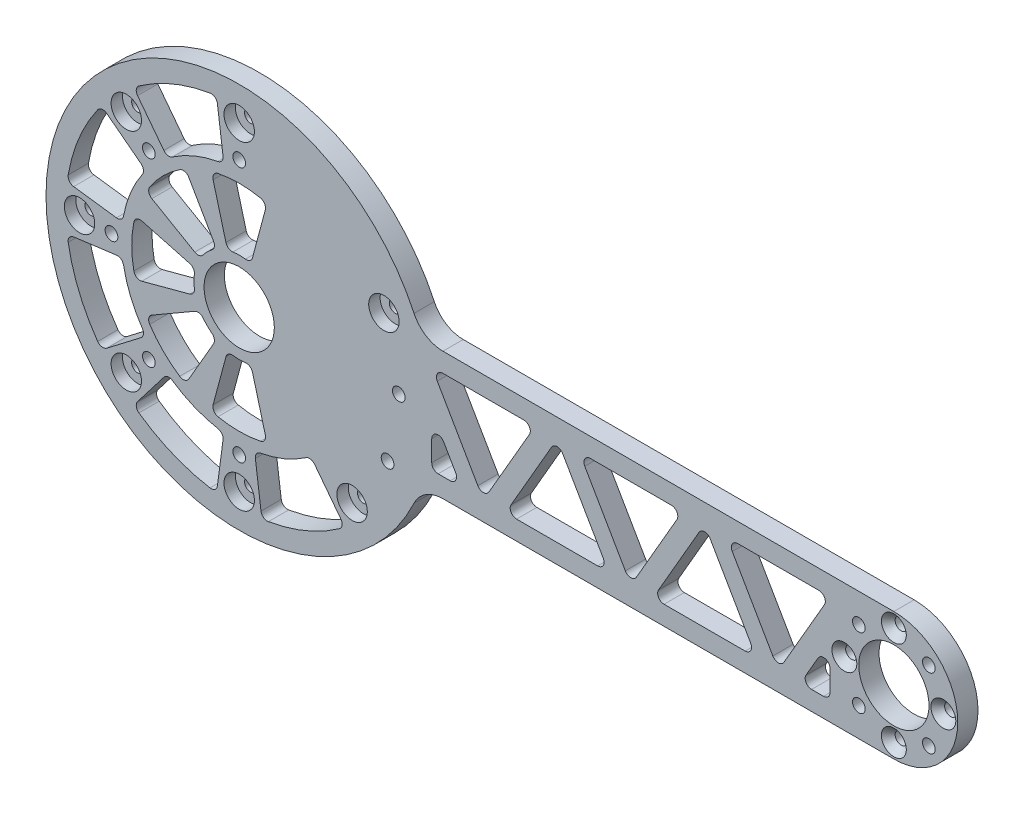
from build123d import *
from OCP.BRepFilletAPI import BRepFilletAPI_MakeChamfer

# Parameters (mm, degrees)
SKETCH1_R                = 11
SKETCH1_R_2              = 1.89865
SKETCH1_R_3              = 1.9939
BOSS_EXTRUDE1_DEPTH      = 6.35
FILLET1_R                = 10
CUT_EXTRUDE1_DEPTH       = 234.078468547
FILLET2_R                = 2
CUT_EXTRUDE2_DEPTH       = 234.078468547
FILLET3_R                = 2
CIRPATTERN1_COUNT        = 8
FILLET3_OF_CIRPATTERN1_R = 2
CUT_EXTRUDE4_DEPTH       = 234.078468547
FILLET5_R                = 2
CIRPATTERN3_COUNT        = 8
FILLET5_OF_CIRPATTERN3_R = 2
CHAMFER1_SIZE            = 2.301024407
CHAMFER1_SIZE2           = 2.00025
CUT_EXTRUDE5_START       = -3.571875
SKETCH6_R                = 4.7625
SKETCH6_R_2              = 1.89865
CUT_EXTRUDE5_DEPTH       = 3.571875


with BuildPart() as part:
    # Sketch1 → Boss-Extrude1 (new body)
    with BuildSketch(Plane.XY):
        with BuildLine():
            Line((57.098598932, -20), (205, -20))
            ThreePointArc((205, -20), (225, 0), (205, 20))
            Line((205, 20), (57.098598932, 20))
            ThreePointArc((57.098598932, 20), (-60.5, 0), (57.098598932, -20))
        make_face()
        Circle(SKETCH1_R, mode=Mode.SUBTRACT)
        with Locations((45.315389352, 21.130913087)):
            Circle(SKETCH1_R_2, mode=Mode.SUBTRACT)
        with Locations((49.978847504, 1.454235937)):
            Circle(SKETCH1_R_3, mode=Mode.SUBTRACT)
        with Locations((205, 0)):
            Circle(SKETCH1_R, mode=Mode.SUBTRACT)
        with Locations((46.467376211, -18.460307366)):
            Circle(SKETCH1_R_3, mode=Mode.SUBTRACT)
        with Locations((205, -15.5)):
            Circle(SKETCH1_R_2, mode=Mode.SUBTRACT)
        with Locations((215.960155108, -10.960155108)):
            Circle(SKETCH1_R_3, mode=Mode.SUBTRACT)
        with Locations((189.5, 0)):
            Circle(SKETCH1_R_2, mode=Mode.SUBTRACT)
        with Locations((194.039844892, -10.960155108)):
            Circle(SKETCH1_R_3, mode=Mode.SUBTRACT)
        with Locations((205, 15.5)):
            Circle(SKETCH1_R_2, mode=Mode.SUBTRACT)
        with Locations((194.039844892, 10.960155108)):
            Circle(SKETCH1_R_3, mode=Mode.SUBTRACT)
        with Locations((220.5, 0)):
            Circle(SKETCH1_R_2, mode=Mode.SUBTRACT)
        with Locations((215.960155108, 10.960155108)):
            Circle(SKETCH1_R_3, mode=Mode.SUBTRACT)
        with Locations((0, -40)):
            Circle(SKETCH1_R_3, mode=Mode.SUBTRACT)
        with Locations((0, -50)):
            Circle(SKETCH1_R_2, mode=Mode.SUBTRACT)
        with Locations((-28.284271247, -28.284271247)):
            Circle(SKETCH1_R_3, mode=Mode.SUBTRACT)
        with Locations((-35.355339059, -35.355339059)):
            Circle(SKETCH1_R_2, mode=Mode.SUBTRACT)
        with Locations((-40, 0)):
            Circle(SKETCH1_R_3, mode=Mode.SUBTRACT)
        with Locations((-50, 0)):
            Circle(SKETCH1_R_2, mode=Mode.SUBTRACT)
        with Locations((-28.284271247, 28.284271247)):
            Circle(SKETCH1_R_3, mode=Mode.SUBTRACT)
        with Locations((-35.355339059, 35.355339059)):
            Circle(SKETCH1_R_2, mode=Mode.SUBTRACT)
        with Locations((0, 40)):
            Circle(SKETCH1_R_3, mode=Mode.SUBTRACT)
        with Locations((0, 50)):
            Circle(SKETCH1_R_2, mode=Mode.SUBTRACT)
        with Locations((35.355339059, -35.355339059)):
            Circle(SKETCH1_R_2, mode=Mode.SUBTRACT)
    extrude(amount=BOSS_EXTRUDE1_DEPTH)

    # Fillet1
    fillet1_edges = [part.edges().sort_by_distance(p)[0] for p in [
        (57.098598932, -20, 3.175),
        (57.098598932, 20, 3.175),
    ]]
    fillet(fillet1_edges, radius=FILLET1_R)

    # Sketch2 → Cut-Extrude1 (cut, through all)
    with BuildSketch(Plane.XY.offset(6.35)):
        Polygon((60.292341855, 14), (92.62395693, 14), (76.458149392, -14), align=None)
        Polygon((83.386352623, -14), (99.55216016, 14), (115.717967697, -14), align=None)
        Polygon((106.48036339, 14), (122.646170928, -14), (138.811978465, 14), align=None)
        Polygon((129.574374158, -14), (145.740181695, 14), (161.905989232, -14), align=None)
        Polygon((152.668384925, 14), (168.834192463, -14), (185, 14), align=None)
        Polygon((60.292341855, 2), (60.292341855, -14), (69.529946162, -14), align=None)
        Polygon((185, 2), (185, -14), (175.762395693, -14), align=None)
    extrude(amount=-CUT_EXTRUDE1_DEPTH, mode=Mode.SUBTRACT)

    # Fillet2
    fillet2_edges = [part.edges().sort_by_distance(p)[0] for p in [
        (175.762395693, -14, 3.175),
        (69.529946162, -14, 3.175),
        (129.574374158, -14, 3.175),
        (83.386352623, -14, 3.175),
        (122.646170928, -14, 3.175),
        (76.458149392, -14, 3.175),
        (60.292341855, -14, 3.175),
        (60.292341855, 2, 3.175),
        (99.55216016, 14, 3.175),
        (145.740181695, 14, 3.175),
        (185, 2, 3.175),
        (115.717967697, -14, 3.175),
        (161.905989232, -14, 3.175),
        (185, -14, 3.175),
        (168.834192463, -14, 3.175),
        (185, 14, 3.175),
        (138.811978465, 14, 3.175),
        (92.62395693, 14, 3.175),
        (152.668384925, 14, 3.175),
        (106.48036339, 14, 3.175),
        (60.292341855, 14, 3.175),
    ]]
    fillet(fillet2_edges, radius=FILLET2_R)

    # Sketch3 → Cut-Extrude2 (cut, through all)
    with BuildSketch(Plane.XY.offset(6.35)):
        with BuildLine():
            Line((-32.503404055, 8.709260868), (-13.691998588, 3.668759964))
            ThreePointArc((-13.691998588, 3.668759964), (-14.175, 0), (-13.691998588, -3.668759964))
            Line((-13.691998588, -3.668759964), (-32.503404055, -8.709260868))
            ThreePointArc((-32.503404055, -8.709260868), (-33.65, 0), (-32.503404055, 8.709260868))
        make_face()
    cut_extrude2 = extrude(amount=-CUT_EXTRUDE2_DEPTH, mode=Mode.SUBTRACT)

    # Fillet3
    fillet3_edges = [part.edges().sort_by_distance(p)[0] for p in [
        (-32.503404055, -8.709260868, 3.175),
        (-13.691998588, -3.668759964, 3.175),
        (-13.691998588, 3.668759964, 3.175),
        (-32.503404055, 8.709260868, 3.175),
    ]]
    fillet(fillet3_edges, radius=FILLET3_R)

    # CirPattern1: Cut-Extrude2 ×8 about axis, 3 skipped
    cirpattern1_axis = Axis((0, 0, 6.35), (0, 0, -1))
    add([cut_extrude2.rotate(cirpattern1_axis, i * 360 / CIRPATTERN1_COUNT) for i in range(1, CIRPATTERN1_COUNT) if i not in (3, 4, 5)], mode=Mode.SUBTRACT)

    # Fillet3 of CirPattern1
    fillet3_of_cirpattern1_edges = [part.edges().sort_by_distance(p)[0] for p in [
        (-29.141754837, 16.825, 3.175),
        (-12.275910099, 7.0875, 3.175),
        (-7.0875, 12.275910099, 3.175),
        (-16.825, 29.141754837, 3.175),
        (-8.709260868, 32.503404055, 3.175),
        (-3.668759964, 13.691998588, 3.175),
        (3.668759964, 13.691998588, 3.175),
        (8.709260868, 32.503404055, 3.175),
        (8.709260868, -32.503404055, 3.175),
        (3.668759964, -13.691998588, 3.175),
        (-3.668759964, -13.691998588, 3.175),
        (-8.709260868, -32.503404055, 3.175),
        (-16.825, -29.141754837, 3.175),
        (-7.0875, -12.275910099, 3.175),
        (-12.275910099, -7.0875, 3.175),
        (-29.141754837, -16.825, 3.175),
    ]]
    fillet(fillet3_of_cirpattern1_edges, radius=FILLET3_OF_CIRPATTERN1_R)

    # Sketch5 → Cut-Extrude4 (cut, through all)
    with BuildSketch(Plane.XY.offset(6.35)):
        with BuildLine():
            Line((-53.860242094, 7.090835392), (-36.50995702, 4.806627029))
            ThreePointArc((-36.50995702, 4.806627029), (-34.021863785, 14.092317397), (-29.215236756, 22.417639623))
            Line((-29.215236756, 22.417639623), (-43.098920211, 33.070964631))
            ThreePointArc((-43.098920211, 33.070964631), (-50.189755604, 20.789277463), (-53.860242094, 7.090835392))
        make_face()
    cut_extrude4 = extrude(amount=-CUT_EXTRUDE4_DEPTH, mode=Mode.SUBTRACT)

    # Fillet5
    fillet5_edges = [part.edges().sort_by_distance(p)[0] for p in [
        (-53.860242094, 7.090835392, 3.175),
        (-36.50995702, 4.806627029, 3.175),
        (-29.215236756, 22.417639623, 3.175),
        (-43.098920211, 33.070964631, 3.175),
    ]]
    fillet(fillet5_edges, radius=FILLET5_R)

    # CirPattern3: Cut-Extrude4 ×8 about axis, 3 skipped
    cirpattern3_axis = Axis((0, 0, 6.35), (0, 0, -1))
    add([cut_extrude4.rotate(cirpattern3_axis, i * 360 / CIRPATTERN3_COUNT) for i in range(1, CIRPATTERN3_COUNT) if i not in (2, 3, 4)], mode=Mode.SUBTRACT)

    # Fillet5 of CirPattern3
    fillet5_of_cirpattern3_edges = [part.edges().sort_by_distance(p)[0] for p in [
        (-33.070964631, 43.098920211, 3.175),
        (-22.417639623, 29.215236756, 3.175),
        (-4.806627029, 36.50995702, 3.175),
        (-7.090835392, 53.860242094, 3.175),
        (33.070964631, -43.098920211, 3.175),
        (22.417639623, -29.215236756, 3.175),
        (4.806627029, -36.50995702, 3.175),
        (7.090835392, -53.860242094, 3.175),
        (-7.090835392, -53.860242094, 3.175),
        (-4.806627029, -36.50995702, 3.175),
        (-22.417639623, -29.215236756, 3.175),
        (-33.070964631, -43.098920211, 3.175),
        (-43.098920211, -33.070964631, 3.175),
        (-29.215236756, -22.417639623, 3.175),
        (-36.50995702, -4.806627029, 3.175),
        (-53.860242094, -7.090835392, 3.175),
    ]]
    fillet(fillet5_of_cirpattern3_edges, radius=FILLET5_OF_CIRPATTERN3_R)

    # Chamfer1: one chamfer whose edges measure the first distance from different faces: ONE call of the kernel's chamfer builder (chamfer() names one face for all edges)
    chamfer1_edges_1 = [part.edges().sort_by_distance(p)[0] for p in [
        (218.60135, 0, 6.35),
    ]]
    chamfer1_side_1 = [part.faces().sort_by_distance(p)[0] for p in [
        (218.60135, 0, 3.175),
    ]]
    chamfer1_edges_2 = [part.edges().sort_by_distance(p)[0] for p in [
        (203.10135, -15.5, 6.35),
    ]]
    chamfer1_side_2 = [part.faces().sort_by_distance(p)[0] for p in [
        (203.10135, -15.5, 3.175),
    ]]
    chamfer1_edges_3 = [part.edges().sort_by_distance(p)[0] for p in [
        (187.60135, 0, 6.35),
    ]]
    chamfer1_side_3 = [part.faces().sort_by_distance(p)[0] for p in [
        (187.60135, 0, 3.175),
    ]]
    chamfer1_edges_4 = [part.edges().sort_by_distance(p)[0] for p in [
        (203.10135, 15.5, 6.35),
    ]]
    chamfer1_side_4 = [part.faces().sort_by_distance(p)[0] for p in [
        (203.10135, 15.5, 3.175),
    ]]
    chamfer1 = BRepFilletAPI_MakeChamfer(part.part.solid().wrapped)
    for e in chamfer1_edges_1:
        chamfer1.Add(CHAMFER1_SIZE, CHAMFER1_SIZE2, e.wrapped, chamfer1_side_1[0].wrapped)  # the first distance lies on this face
    for e in chamfer1_edges_2:
        chamfer1.Add(CHAMFER1_SIZE, CHAMFER1_SIZE2, e.wrapped, chamfer1_side_2[0].wrapped)  # the first distance lies on this face
    for e in chamfer1_edges_3:
        chamfer1.Add(CHAMFER1_SIZE, CHAMFER1_SIZE2, e.wrapped, chamfer1_side_3[0].wrapped)  # the first distance lies on this face
    for e in chamfer1_edges_4:
        chamfer1.Add(CHAMFER1_SIZE, CHAMFER1_SIZE2, e.wrapped, chamfer1_side_4[0].wrapped)  # the first distance lies on this face
    add(Compound.cast(chamfer1.Shape()), mode=Mode.REPLACE)

    # Sketch6 → Cut-Extrude5 (cut)
    # profile 1 of 7: a face of its own
    with BuildSketch(Plane.XY.offset(6.35).offset(CUT_EXTRUDE5_START)):
        with Locations((0, 50)):
            Circle(SKETCH6_R)
        with Locations((0, 50)):
            Circle(SKETCH6_R_2, mode=Mode.SUBTRACT)
    # profile 2 of 7: a face of its own
    with BuildSketch(Plane.XY.offset(6.35).offset(CUT_EXTRUDE5_START)):
        with Locations((-35.355339059, 35.355339059)):
            Circle(SKETCH6_R)
        with Locations((-35.355339059, 35.355339059)):
            Circle(SKETCH6_R_2, mode=Mode.SUBTRACT)
    # profile 3 of 7: a face of its own
    with BuildSketch(Plane.XY.offset(6.35).offset(CUT_EXTRUDE5_START)):
        with Locations((-50, 0)):
            Circle(SKETCH6_R)
        with Locations((-50, 0)):
            Circle(SKETCH6_R_2, mode=Mode.SUBTRACT)
    # profile 4 of 7: a face of its own
    with BuildSketch(Plane.XY.offset(6.35).offset(CUT_EXTRUDE5_START)):
        with Locations((-35.355339059, -35.355339059)):
            Circle(SKETCH6_R)
        with Locations((-35.355339059, -35.355339059)):
            Circle(SKETCH6_R_2, mode=Mode.SUBTRACT)
    # profile 5 of 7: a face of its own
    with BuildSketch(Plane.XY.offset(6.35).offset(CUT_EXTRUDE5_START)):
        with Locations((0, -50)):
            Circle(SKETCH6_R)
        with Locations((0, -50)):
            Circle(SKETCH6_R_2, mode=Mode.SUBTRACT)
    # profile 6 of 7: a face of its own
    with BuildSketch(Plane.XY.offset(6.35).offset(CUT_EXTRUDE5_START)):
        with Locations((35.355339059, -35.355339059)):
            Circle(SKETCH6_R)
        with Locations((35.355339059, -35.355339059)):
            Circle(SKETCH6_R_2, mode=Mode.SUBTRACT)
    # profile 7 of 7: a face of its own
    with BuildSketch(Plane.XY.offset(6.35).offset(CUT_EXTRUDE5_START)):
        with Locations((45.315389352, 21.130913087)):
            Circle(SKETCH6_R)
        with Locations((45.315389352, 21.130913087)):
            Circle(SKETCH6_R_2, mode=Mode.SUBTRACT)
    extrude(amount=CUT_EXTRUDE5_DEPTH, mode=Mode.SUBTRACT)


solid = part.part
